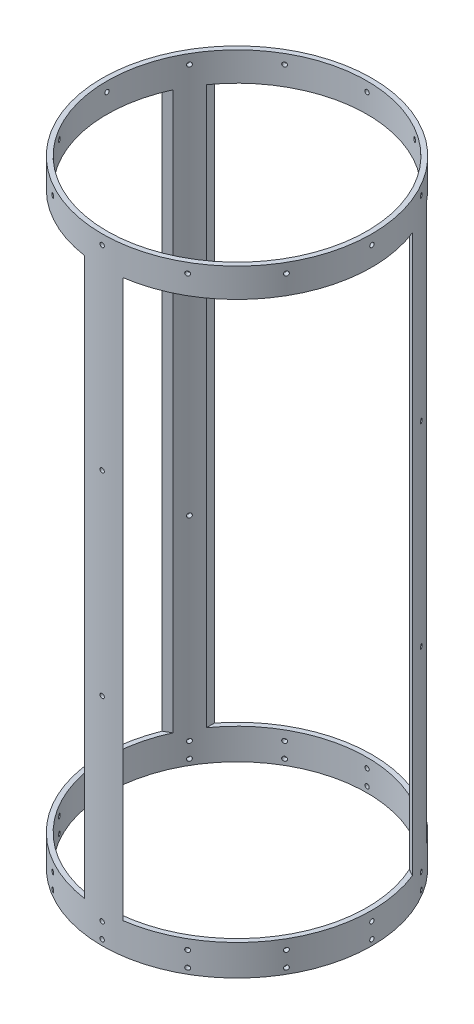
from build123d import *

# Parameters (mm, degrees)
SKETCH1_R               = 88.9
SKETCH1_R_2             = 85.725
BOSS_EXTRUDE1_DEPTH     = 203.2
CUT_EXTRUDE1_REACH      = 240.949
CUT_EXTRUDE1_END_RADIUS = 88.9
SKETCH2_W               = 139.7
SKETCH2_H               = 367.03
CIRPATTERN1_COUNT       = 3
SKETCH3_R               = 1.4351
CUT_EXTRUDE2_DEPTH      = 15.24
CIRPATTERN2_COUNT       = 12
SKETCH4_R               = 1.4351
CUT_EXTRUDE3_DEPTH      = 15.24
CIRPATTERN3_COUNT       = 12
SKETCH5_R               = 1.4351
CUT_EXTRUDE4_DEPTH      = 35.56
CIRPATTERN4_COUNT       = 3


with BuildPart() as part:
    # Sketch1 → Boss-Extrude1 (new, symmetric)
    with BuildSketch(Plane(origin=(0, 0, 0), x_dir=(1, 0, 0), z_dir=(0, 1, 0))):
        Circle(SKETCH1_R)
        Circle(SKETCH1_R_2, mode=Mode.SUBTRACT)
    extrude(amount=BOSS_EXTRUDE1_DEPTH, both=True)

    # Cut-Extrude1: up to this cylinder (the profile starts inside it)
    cut_extrude1_end = Plane(origin=(0, 0.635, 0), z_dir=(0, -1, 0)) * Cylinder(CUT_EXTRUDE1_END_RADIUS, 660.698, mode=Mode.PRIVATE)
    # Sketch2 → Cut-Extrude1 (cut, up to the surface)
    with BuildSketch(Plane.XY, mode=Mode.PRIVATE) as cut_extrude1_sk1:
        with Locations((0, 0.635)):
            Rectangle(SKETCH2_W, SKETCH2_H)
    cut_extrude1_tool1 = extrude(cut_extrude1_sk1.sketch, amount=-CUT_EXTRUDE1_REACH, mode=Mode.PRIVATE) & cut_extrude1_end
    cut_extrude1 = cut_extrude1_tool1.solids().sort_by_distance((0, 0.635, 0))[0]
    add(cut_extrude1, mode=Mode.SUBTRACT)

    # CirPattern1: Cut-Extrude1 ×3 about axis
    cirpattern1_axis = Axis((0, 203.2, 0), (0, -1, 0))
    for i in range(1, CIRPATTERN1_COUNT):
        add(cut_extrude1.rotate(cirpattern1_axis, i * 360 / CIRPATTERN1_COUNT), mode=Mode.SUBTRACT)

    # Sketch3 → Cut-Extrude2 (cut)
    with BuildSketch(Plane(origin=(88.9, 0, 0), x_dir=(0, 0, -1), z_dir=(1, 0, 0))):
        with Locations((0, -199.39)):
            Circle(SKETCH3_R)
        with Locations((0, -189.23)):
            Circle(SKETCH3_R)
    cut_extrude2 = extrude(amount=-CUT_EXTRUDE2_DEPTH, mode=Mode.SUBTRACT)

    # CirPattern2: Cut-Extrude2 ×12 about axis
    cirpattern2_axis = Axis((0, 203.2, 0), (0, -1, 0))
    for i in range(1, CIRPATTERN2_COUNT):
        add(cut_extrude2.rotate(cirpattern2_axis, i * 360 / CIRPATTERN2_COUNT), mode=Mode.SUBTRACT)

    # Sketch4 → Cut-Extrude3 (cut)
    with BuildSketch(Plane(origin=(88.9, 0, 0), x_dir=(0, 0, -1), z_dir=(1, 0, 0))):
        with Locations((0, 196.85)):
            Circle(SKETCH4_R)
    cut_extrude3 = extrude(amount=-CUT_EXTRUDE3_DEPTH, mode=Mode.SUBTRACT)

    # CirPattern3: Cut-Extrude3 ×12 about axis
    cirpattern3_axis = Axis((0, 203.2, 0), (0, -1, 0))
    for i in range(1, CIRPATTERN3_COUNT):
        add(cut_extrude3.rotate(cirpattern3_axis, i * 360 / CIRPATTERN3_COUNT), mode=Mode.SUBTRACT)

    # Sketch5 → Cut-Extrude4 (cut)
    with BuildSketch(Plane.XY.offset(88.9)):
        with Locations((0, 68.1736)):
            Circle(SKETCH5_R)
        with Locations((0, -60.5536)):
            Circle(SKETCH5_R)
    cut_extrude4 = extrude(amount=-CUT_EXTRUDE4_DEPTH, mode=Mode.SUBTRACT)

    # CirPattern4: Cut-Extrude4 ×3 about axis
    cirpattern4_axis = Axis((0, 203.2, 0), (0, -1, 0))
    for i in range(1, CIRPATTERN4_COUNT):
        add(cut_extrude4.rotate(cirpattern4_axis, i * 360 / CIRPATTERN4_COUNT), mode=Mode.SUBTRACT)


solid = part.part
